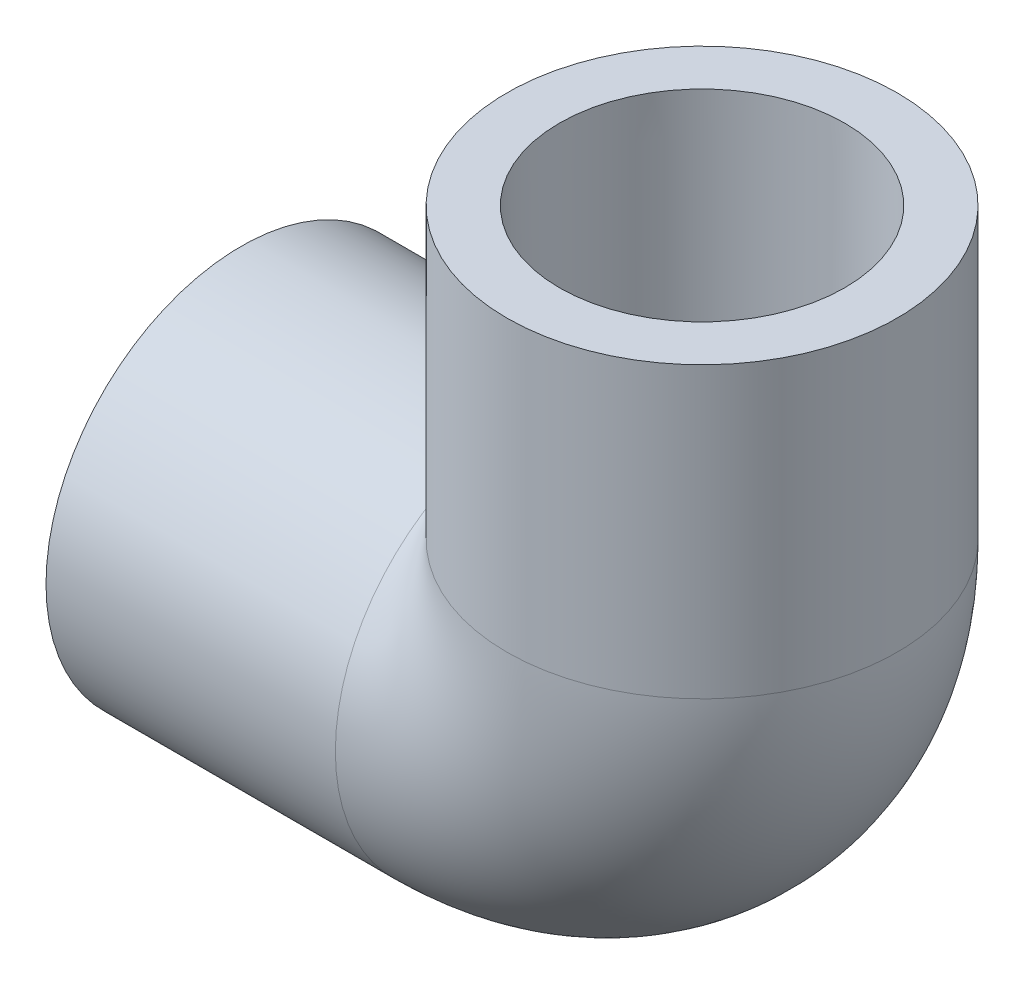
from build123d import *

# Parameters (mm, degrees)
SKETCH3_R   = 14.732
SKETCH3_R_2 = 6.9342


with BuildPart() as part:
    # Sketch1 → Revolve1 (revolve)
    with BuildSketch(Plane.XY):
        Polygon((-34.798, -14.732), (-12.954, -14.732), (-12.954, -10.6172), (-34.798, -10.7696), align=None)
    revolve(axis=Axis((-34.798, 0, 0), (1, 0, 0)))


with BuildPart() as body_2:
    # Sketch2 → Revolve2 (revolve)
    with BuildSketch(Plane.XY):
        Polygon((10.7696, 34.798), (10.6172, 12.954), (14.732, 12.954), (14.732, 34.798), align=None)
    revolve(axis=Axis((0, 0, 0), (0, 1, 0)))


with BuildPart() as sweep1_tool:
    # Sweep1: sweep along a path in Sketch4
    with BuildLine(Plane.XY) as sweep1_path:
        ThreePointArc((-12.954, 0), (-3.794139, 3.794139), (0, 12.954))
    # Sketch3 → Sweep1 (sweep)
    with BuildSketch(Plane(origin=(-12.954, 0, 0), x_dir=(0, 0, -1), z_dir=(1, 0, 0))):
        Circle(SKETCH3_R)
        Circle(SKETCH3_R_2, mode=Mode.SUBTRACT)
    sweep(path=sweep1_path.line)


with BuildPart() as part_1:
    add(part.part)


with BuildPart() as part_2:
    # Sweep1: joined with sweep1_tool
    add(part_1.part.fuse(sweep1_tool.part, body_2.part, tol=0.00001))


solid = part_2.part
